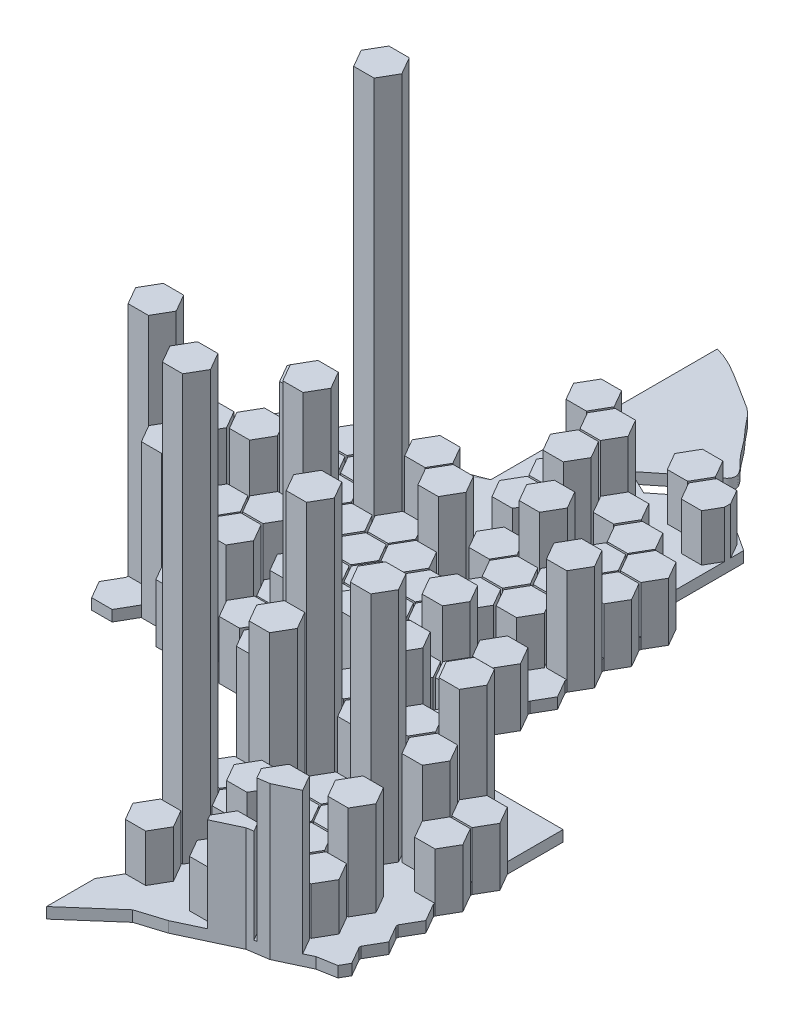
from build123d import *

# Parameters (mm, degrees)
BOSS_EXTRUDE12_DEPTH = 3
BOSS_EXTRUDE13_DEPTH = 120
BOSS_EXTRUDE14_DEPTH = 42
BOSS_EXTRUDE15_DEPTH = 55
BOSS_EXTRUDE16_DEPTH = 68
BOSS_EXTRUDE17_DEPTH = 81
BOSS_EXTRUDE18_DEPTH = 29
BOSS_EXTRUDE19_DEPTH = 16
BOSS_EXTRUDE20_DEPTH = 3
BOSS_EXTRUDE21_DEPTH = 120
BOSS_EXTRUDE22_DEPTH = 81
BOSS_EXTRUDE23_DEPTH = 68
BOSS_EXTRUDE24_DEPTH = 55
BOSS_EXTRUDE25_DEPTH = 42
BOSS_EXTRUDE26_DEPTH = 29
BOSS_EXTRUDE27_DEPTH = 16
BOSS_EXTRUDE28_DEPTH = 3


with BuildPart() as part:
    # Sketch3 → Boss-Extrude12 (new body)
    with BuildSketch(Plane(origin=(0, 0, 0), x_dir=(1, 0, 0), z_dir=(0, 1, 0))):
        with BuildLine():
            add(Edge.make_bspline(
                [(327.696422715, 392.996501101), (333.211608056, 391.498083369), (338.931516771, 386.942494272), (347.132971998, 382.475501932), (349.931165971, 378.312391077), (353.644737091, 374.582038125), (356.261352126, 370.377108225), (359.486044356, 367.677493711), (361.180965416, 364.785458454), (359.784420463, 363.045758677), (358.814740481, 362.845829064)],
                knots=[0, 0, 0, 0, 0.351189458, 0.469328893, 0.584138689, 0.66408283, 0.80511427, 0.892512409, 0.936418584, 1, 1, 1, 1], degree=3))
            Line((327.696422715, 392.996501101), (327.696422715, 330.573102784))
            Line((327.696422715, 330.573102784), (297.971815144, 313.537431679))
            Line((297.971815144, 313.537431679), (297.951251248, 303.301813965))
            Line((297.951251248, 303.301813965), (300.730836157, 308.116196251))
            Line((300.730836157, 308.116196251), (306.331133768, 308.116196251))
            Line((306.331133768, 308.116196251), (309.131282573, 303.266196251))
            Line((309.131282573, 303.266196251), (306.331133768, 298.416196251))
            Line((306.331133768, 298.416196251), (300.730836157, 298.416196251))
            Line((300.730836157, 298.416196251), (297.951108628, 303.230825561))
            Line((297.951108628, 303.230825561), (297.930687351, 293.066196251))
            Line((297.930687351, 293.066196251), (300.730836157, 297.916196251))
            Line((300.730836157, 297.916196251), (306.331133768, 297.916196251))
            Line((306.331133768, 297.916196251), (309.131282573, 293.066196251))
            Line((309.131282573, 293.066196251), (306.331133768, 288.216196251))
            Line((306.331133768, 288.216196251), (300.730836157, 288.216196251))
            Line((300.730836157, 288.216196251), (300.730836157, 287.716196251))
            Line((300.730836157, 287.716196251), (306.331133768, 287.716196251))
            Line((306.331133768, 287.716196251), (309.131282573, 282.866196251))
            Line((309.131282573, 282.866196251), (306.331133768, 278.016196251))
            Line((306.331133768, 278.016196251), (300.730836157, 278.016196251))
            Line((300.730836157, 278.016196251), (297.930687351, 282.866196251))
            Line((297.930687351, 282.866196251), (297.930687351, 272.666196252))
            Line((297.930687351, 272.666196252), (300.730836157, 277.516196252))
            Line((300.730836157, 277.516196252), (306.331133768, 277.516196252))
            Line((306.331133768, 277.516196252), (309.131282573, 272.666196252))
            Line((309.131282573, 272.666196252), (306.331133768, 267.816196252))
            Line((306.331133768, 267.816196252), (300.730836157, 267.816196252))
            Line((300.730836157, 267.816196252), (300.730836157, 267.316196252))
            Line((300.730836157, 267.316196252), (306.331133768, 267.316196252))
            Line((306.331133768, 267.316196252), (309.131282573, 262.466196252))
            Line((309.131282573, 262.466196252), (306.331133768, 257.616196252))
            Line((306.331133768, 257.616196252), (300.730836157, 257.616196252))
            Line((300.730836157, 257.616196252), (300.730836157, 257.001391466))
            Line((300.730836157, 257.001391466), (298.036736799, 252.335074498))
            Line((298.036736799, 252.335074498), (300.856971213, 247.450285203))
            Line((300.856971213, 247.450285203), (306.497440042, 247.450285203))
            Line((306.497440042, 247.450285203), (309.451585771, 252.567015698))
            Line((309.451585771, 252.567015698), (306.680156483, 257.367272033))
            Line((306.680156483, 257.367272033), (309.480305289, 262.217272033))
            Line((309.480305289, 262.217272033), (315.0806029, 262.217272033))
            Line((315.0806029, 262.217272033), (317.880751706, 257.367272033))
            Line((317.880751706, 257.367272033), (315.0806029, 252.517272033))
            Line((315.0806029, 252.517272033), (315.567085831, 252.464504906))
            Line((315.567085831, 252.464504906), (318.367234637, 257.314504906))
            Line((318.367234637, 257.314504906), (323.967532248, 257.314504906))
            Line((323.967532248, 257.314504906), (326.767681054, 252.464504906))
            Line((326.767681054, 252.464504906), (327.180305289, 252.517272033))
            Line((327.180305289, 252.517272033), (324.380156483, 257.367272033))
            Line((324.380156483, 257.367272033), (327.180305289, 262.217272033))
            Line((327.180305289, 262.217272033), (332.7806029, 262.217272033))
            Line((332.7806029, 262.217272033), (335.580751706, 257.367272033))
            Line((335.580751706, 257.367272033), (332.7806029, 252.517272033))
            Line((332.7806029, 252.517272033), (333.111747439, 252.387893043))
            Line((333.111747439, 252.387893043), (335.911896244, 257.237893043))
            Line((335.911896244, 257.237893043), (341.512193856, 257.237893043))
            Line((341.512193856, 257.237893043), (344.312342661, 252.387893043))
            Line((344.312342661, 252.387893043), (344.880305289, 252.517272033))
            Line((344.880305289, 252.517272033), (342.080156483, 257.367272033))
            Line((342.080156483, 257.367272033), (344.880305289, 262.217272033))
            Line((344.880305289, 262.217272033), (350.4806029, 262.217272033))
            Line((350.4806029, 262.217272033), (353.280751705, 257.367272033))
            Line((353.280751705, 257.367272033), (350.4806029, 252.517272033))
            Line((350.4806029, 252.517272033), (350.632478912, 252.377572987))
            Line((350.632478912, 252.377572987), (353.432627718, 257.227572987))
            Line((353.432627718, 257.227572987), (359.032925329, 257.227572987))
            Line((359.032925329, 257.227572987), (361.833074135, 252.377572987))
            Line((361.833074135, 252.377572987), (362.580305288, 252.517272033))
            Line((362.580305288, 252.517272033), (359.780156483, 257.367272033))
            Line((359.780156483, 257.367272033), (362.580305288, 262.217272033))
            Line((362.580305288, 262.217272033), (368.180602899, 262.217272033))
            Line((368.180602899, 262.217272033), (370.980751705, 257.367272033))
            Line((370.980751705, 257.367272033), (371.530836156, 257.616196252))
            Line((371.530836156, 257.616196252), (368.73068735, 262.466196252))
            Line((368.73068735, 262.466196252), (371.530836156, 267.316196252))
            Line((371.530836156, 267.316196252), (377.131133767, 267.316196252))
            Line((377.131133767, 267.316196252), (379.931282572, 262.466196252))
            Line((379.931282572, 262.466196252), (377.131133767, 257.616196252))
            Line((377.131133767, 257.616196252), (377.480156483, 257.367272033))
            Line((377.480156483, 257.367272033), (380.280305288, 252.517272033))
            Line((380.280305288, 252.517272033), (385.880602899, 252.517272033))
            Line((385.880602899, 252.517272033), (388.680751705, 257.367272033))
            Line((388.680751705, 257.367272033), (385.880602899, 262.217272033))
            Line((385.880602899, 262.217272033), (385.880602899, 262.717272032))
            Line((385.880602899, 262.717272032), (380.280305288, 262.717272032))
            Line((380.280305288, 262.717272032), (377.480156483, 267.567272032))
            Line((377.480156483, 267.567272032), (380.280305288, 272.417272032))
            Line((380.280305288, 272.417272032), (385.880602899, 272.417272032))
            Line((385.880602899, 272.417272032), (385.880602899, 272.917272032))
            Line((385.880602899, 272.917272032), (380.280305288, 272.917272032))
            Line((380.280305288, 272.917272032), (377.480156483, 277.767272032))
            Line((377.480156483, 277.767272032), (380.280305288, 282.617272032))
            Line((380.280305288, 282.617272032), (385.880602899, 282.617272032))
            Line((385.880602899, 282.617272032), (385.880602899, 283.117272032))
            Line((385.880602899, 283.117272032), (388.680751705, 287.967272032))
            Line((388.680751705, 287.967272032), (385.880602899, 292.817272032))
            Line((385.880602899, 292.817272032), (385.880602899, 293.317272032))
            Line((385.880602899, 293.317272032), (380.280305288, 293.317272032))
            Line((380.280305288, 293.317272032), (377.480156483, 298.167272032))
            Line((377.480156483, 298.167272032), (380.280305288, 303.017272032))
            Line((380.280305288, 303.017272032), (385.880602899, 303.017272032))
            Line((385.880602899, 303.017272032), (385.880602899, 303.517272032))
            Line((385.880602899, 303.517272032), (380.280305288, 303.517272032))
            Line((380.280305288, 303.517272032), (377.480156483, 308.367272032))
            Line((377.480156483, 308.367272032), (380.280305288, 313.217272032))
            Line((380.280305288, 313.217272032), (385.880602899, 313.217272032))
            Line((385.880602899, 313.217272032), (385.880602899, 313.717272032))
            Line((385.880602899, 313.717272032), (380.280305288, 313.717272032))
            Line((380.280305288, 313.717272032), (377.480156483, 318.567272032))
            Line((377.480156483, 318.567272032), (380.280305288, 323.417272032))
            Line((380.280305288, 323.417272032), (379.931282572, 323.666196251))
            Line((379.931282572, 323.666196251), (377.131133767, 318.816196251))
            Line((377.131133767, 318.816196251), (371.530836156, 318.816196251))
            Line((371.530836156, 318.816196251), (368.73068735, 323.666196251))
            Line((368.73068735, 323.666196251), (371.530836156, 328.516196251))
            Line((371.530836156, 328.516196251), (377.131133767, 328.516196251))
            Line((377.131133767, 328.516196251), (379.433209097, 324.528884816))
            Line((379.433209097, 324.528884816), (379.433209097, 325.384485675))
            Line((379.433209096, 325.384485675), (379.433209097, 342.35005839))
            Line((379.433209097, 342.35005839), (379.433209097, 343.203507686))
            Line((379.433209097, 343.203507686), (377.131133767, 339.216196251))
            Line((377.131133767, 339.216196251), (371.530836156, 339.216196251))
            Line((371.530836156, 339.216196251), (368.73068735, 344.066196251))
            Line((368.73068735, 344.066196251), (371.530836156, 348.916196251))
            Line((371.530836156, 348.916196251), (377.131133767, 348.916196251))
            Line((377.131133767, 348.916196251), (379.433209097, 344.928884816))
            Line((379.433209097, 344.928884816), (379.433209097, 348.497258726))
            Line((379.433209097, 348.497258726), (377.733327772, 349.605777568))
            Line((377.733327772, 349.605777568), (364.284550246, 358.375932917))
            Line((364.284550246, 358.375932917), (351.891304443, 348.497258725))
            Line((351.891304443, 348.497258725), (344.967868406, 351.808467264))
            Line((344.967868406, 351.808467264), (347.738914387, 354.017272032))
            Line((347.738914387, 354.017272031), (358.814740481, 362.845829064))
        make_face()
        Polygon((306.680156483, 267.567272032), (309.480305289, 272.417272032), (315.0806029, 272.417272032), (317.880751706, 267.567272032), (315.0806029, 262.717272032), (309.480305289, 262.717272032), align=None, mode=Mode.SUBTRACT)
        Polygon((318.430836156, 267.316196252), (324.031133767, 267.316196252), (326.831282573, 262.466196252), (324.031133767, 257.616196252), (318.430836156, 257.616196252), (315.630687351, 262.466196252), align=None, mode=Mode.SUBTRACT)
        Polygon((306.680156483, 277.767272032), (309.480305289, 282.617272032), (315.0806029, 282.617272032), (317.880751706, 277.767272032), (315.0806029, 272.917272032), (309.480305289, 272.917272032), align=None, mode=Mode.SUBTRACT)
        Polygon((318.430836156, 277.516196252), (324.031133767, 277.516196252), (326.831282573, 272.666196252), (324.031133767, 267.816196252), (318.430836156, 267.816196252), (315.630687351, 272.666196252), align=None, mode=Mode.SUBTRACT)
        Polygon((318.430836156, 287.716196251), (324.031133767, 287.716196251), (326.831282573, 282.866196251), (324.031133767, 278.016196251), (318.430836156, 278.016196251), (315.630687351, 282.866196251), align=None, mode=Mode.SUBTRACT)
        Polygon((324.380156483, 267.567272032), (327.180305289, 272.417272032), (332.7806029, 272.417272032), (335.580751706, 267.567272032), (332.7806029, 262.717272032), (327.180305289, 262.717272032), align=None, mode=Mode.SUBTRACT)
        Polygon((336.130836156, 267.316196252), (341.731133767, 267.316196252), (344.531282573, 262.466196252), (341.731133767, 257.616196252), (336.130836156, 257.616196252), (333.33068735, 262.466196252), align=None, mode=Mode.SUBTRACT)
        Polygon((324.380156483, 277.767272032), (327.180305289, 282.617272032), (332.7806029, 282.617272032), (335.580751706, 277.767272032), (332.7806029, 272.917272032), (327.180305289, 272.917272032), align=None, mode=Mode.SUBTRACT)
        Polygon((336.130836156, 277.516196252), (341.731133767, 277.516196252), (344.531282573, 272.666196252), (341.731133767, 267.816196252), (336.130836156, 267.816196252), (333.33068735, 272.666196252), align=None, mode=Mode.SUBTRACT)
        Polygon((336.130836156, 287.716196251), (341.731133767, 287.716196251), (344.531282573, 282.866196251), (341.731133767, 278.016196251), (336.130836156, 278.016196251), (333.33068735, 282.866196251), align=None, mode=Mode.SUBTRACT)
        Polygon((306.680156483, 287.967272032), (309.480305289, 292.817272032), (315.0806029, 292.817272032), (317.880751706, 287.967272032), (315.0806029, 283.117272032), (309.480305289, 283.117272032), align=None, mode=Mode.SUBTRACT)
        Polygon((318.430836156, 297.916196251), (324.031133767, 297.916196251), (326.831282573, 293.066196251), (324.031133767, 288.216196251), (318.430836156, 288.216196251), (315.630687351, 293.066196251), align=None, mode=Mode.SUBTRACT)
        Polygon((306.680156483, 298.167272032), (309.480305289, 303.017272032), (315.0806029, 303.017272032), (317.880751706, 298.167272032), (315.0806029, 293.317272032), (309.480305289, 293.317272032), align=None, mode=Mode.SUBTRACT)
        Polygon((318.430836156, 308.116196251), (324.031133767, 308.116196251), (326.831282573, 303.266196251), (324.031133767, 298.416196251), (318.430836156, 298.416196251), (315.630687351, 303.266196251), align=None, mode=Mode.SUBTRACT)
        Polygon((324.380156483, 287.967272032), (327.180305289, 292.817272032), (332.7806029, 292.817272032), (335.580751706, 287.967272032), (332.7806029, 283.117272032), (327.180305289, 283.117272032), align=None, mode=Mode.SUBTRACT)
        Polygon((336.130836156, 297.916196251), (341.731133767, 297.916196251), (344.531282573, 293.066196251), (341.731133767, 288.216196251), (336.130836156, 288.216196251), (333.33068735, 293.066196251), align=None, mode=Mode.SUBTRACT)
        Polygon((324.380156483, 298.167272032), (327.180305289, 303.017272032), (332.7806029, 303.017272032), (335.580751706, 298.167272032), (332.7806029, 293.317272032), (327.180305289, 293.317272032), align=None, mode=Mode.SUBTRACT)
        Polygon((336.130836156, 308.116196251), (341.731133767, 308.116196251), (344.531282573, 303.266196251), (341.731133767, 298.416196251), (336.130836156, 298.416196251), (333.33068735, 303.266196251), align=None, mode=Mode.SUBTRACT)
        Polygon((342.080156483, 267.567272032), (344.880305289, 272.417272032), (350.4806029, 272.417272032), (353.280751705, 267.567272032), (350.4806029, 262.717272032), (344.880305289, 262.717272032), align=None, mode=Mode.SUBTRACT)
        Polygon((353.830836156, 267.316196252), (359.431133767, 267.316196252), (362.231282573, 262.466196252), (359.431133767, 257.616196252), (353.830836156, 257.616196252), (351.03068735, 262.466196252), align=None, mode=Mode.SUBTRACT)
        Polygon((342.080156483, 277.767272032), (344.880305289, 282.617272032), (350.4806029, 282.617272032), (353.280751705, 277.767272032), (350.4806029, 272.917272032), (344.880305289, 272.917272032), align=None, mode=Mode.SUBTRACT)
        Polygon((353.830836156, 277.516196252), (359.431133767, 277.516196252), (362.231282573, 272.666196252), (359.431133767, 267.816196252), (353.830836156, 267.816196252), (351.03068735, 272.666196252), align=None, mode=Mode.SUBTRACT)
        Polygon((353.830836156, 287.716196251), (359.431133767, 287.716196251), (362.231282573, 282.866196251), (359.431133767, 278.016196251), (353.830836156, 278.016196251), (351.03068735, 282.866196251), align=None, mode=Mode.SUBTRACT)
        Polygon((359.780156483, 267.567272032), (362.580305288, 272.417272032), (368.180602899, 272.417272032), (370.980751705, 267.567272032), (368.180602899, 262.717272032), (362.580305288, 262.717272032), align=None, mode=Mode.SUBTRACT)
        Polygon((359.780156483, 277.767272032), (362.580305288, 282.617272032), (368.180602899, 282.617272032), (370.980751705, 277.767272032), (368.180602899, 272.917272032), (362.580305288, 272.917272032), align=None, mode=Mode.SUBTRACT)
        Polygon((371.530836156, 277.516196252), (377.131133767, 277.516196252), (379.931282572, 272.666196252), (377.131133767, 267.816196252), (371.530836156, 267.816196252), (368.73068735, 272.666196252), align=None, mode=Mode.SUBTRACT)
        Polygon((342.080156483, 287.967272032), (344.880305289, 292.817272032), (350.4806029, 292.817272032), (353.280751705, 287.967272032), (350.4806029, 283.117272032), (344.880305289, 283.117272032), align=None, mode=Mode.SUBTRACT)
        Polygon((342.080156483, 298.167272032), (344.880305289, 303.017272032), (350.4806029, 303.017272032), (353.280751705, 298.167272032), (350.4806029, 293.317272032), (344.880305289, 293.317272032), align=None, mode=Mode.SUBTRACT)
        Polygon((353.830836156, 308.116196251), (359.431133767, 308.116196251), (362.231282573, 303.266196251), (359.431133767, 298.416196251), (353.830836156, 298.416196251), (351.03068735, 303.266196251), align=None, mode=Mode.SUBTRACT)
        Polygon((359.780156483, 287.967272032), (362.580305288, 292.817272032), (368.180602899, 292.817272032), (370.980751705, 287.967272032), (368.180602899, 283.117272032), (362.580305288, 283.117272032), align=None, mode=Mode.SUBTRACT)
        Polygon((371.530836156, 297.916196251), (377.131133767, 297.916196251), (379.931282572, 293.066196251), (377.131133767, 288.216196251), (371.530836156, 288.216196251), (368.73068735, 293.066196251), align=None, mode=Mode.SUBTRACT)
        Polygon((359.780156483, 298.167272032), (362.580305288, 303.017272032), (368.180602899, 303.017272032), (370.980751705, 298.167272032), (368.180602899, 293.317272032), (362.580305288, 293.317272032), align=None, mode=Mode.SUBTRACT)
        Polygon((371.530836156, 308.116196251), (377.131133767, 308.116196251), (379.931282572, 303.266196251), (377.131133767, 298.416196251), (371.530836156, 298.416196251), (368.73068735, 303.266196251), align=None, mode=Mode.SUBTRACT)
        Polygon((306.680156483, 308.367272032), (309.480305289, 313.217272032), (315.0806029, 313.217272032), (317.880751706, 308.367272032), (315.0806029, 303.517272032), (309.480305289, 303.517272032), align=None, mode=Mode.SUBTRACT)
        Polygon((324.380156483, 308.367272032), (327.180305289, 313.217272032), (332.7806029, 313.217272032), (335.580751706, 308.367272032), (332.7806029, 303.517272032), (327.180305289, 303.517272032), align=None, mode=Mode.SUBTRACT)
        Polygon((342.080156483, 318.567272032), (344.880305289, 323.417272032), (350.4806029, 323.417272032), (353.280751705, 318.567272032), (350.4806029, 313.717272032), (344.880305289, 313.717272032), align=None, mode=Mode.SUBTRACT)
        Polygon((342.080156483, 328.767272032), (344.880305289, 333.617272032), (350.4806029, 333.617272032), (353.280751705, 328.767272032), (350.4806029, 323.917272032), (344.880305289, 323.917272032), align=None, mode=Mode.SUBTRACT)
        Polygon((353.830836156, 328.516196251), (359.431133767, 328.516196251), (362.231282573, 323.666196251), (359.431133767, 318.816196251), (353.830836156, 318.816196251), (351.03068735, 323.666196251), align=None, mode=Mode.SUBTRACT)
        Polygon((359.780156483, 308.367272032), (362.580305288, 313.217272032), (368.180602899, 313.217272032), (370.980751705, 308.367272032), (368.180602899, 303.517272032), (362.580305288, 303.517272032), align=None, mode=Mode.SUBTRACT)
        Polygon((371.530836156, 318.316196251), (377.131133767, 318.316196251), (379.931282572, 313.466196251), (377.131133767, 308.616196251), (371.530836156, 308.616196251), (368.73068735, 313.466196251), align=None, mode=Mode.SUBTRACT)
        Polygon((359.780156483, 328.767272032), (362.580305288, 333.617272032), (368.180602899, 333.617272032), (370.980751705, 328.767272032), (368.180602899, 323.917272032), (362.580305288, 323.917272032), align=None, mode=Mode.SUBTRACT)
        Polygon((342.080156483, 338.967272032), (344.880305289, 343.817272032), (350.4806029, 343.817272032), (353.280751705, 338.967272032), (350.4806029, 334.117272032), (344.880305289, 334.117272032), align=None, mode=Mode.SUBTRACT)
        Polygon((353.830836156, 338.716196251), (359.431133767, 338.716196251), (362.231282573, 333.866196251), (359.431133767, 329.016196251), (353.830836156, 329.016196251), (351.03068735, 333.866196251), align=None, mode=Mode.SUBTRACT)
        Polygon((359.780156483, 349.167272031), (362.580305288, 354.017272031), (368.180602899, 354.017272031), (370.980751705, 349.167272031), (368.180602899, 344.317272031), (362.580305288, 344.317272031), align=None, mode=Mode.SUBTRACT)
    extrude(amount=BOSS_EXTRUDE12_DEPTH)

    # Sketch3<3> → Boss-Extrude13 (add)
    with BuildSketch(Plane(origin=(0, 0, 0), x_dir=(1, 0, 0), z_dir=(0, 1, 0))):
        Polygon((327.180305289, 303.017272032), (324.380156483, 298.167272032), (327.180305289, 293.317272032), (332.7806029, 293.317272032), (335.580751706, 298.167272032), (332.7806029, 303.017272032), align=None)
    extrude(amount=BOSS_EXTRUDE13_DEPTH)

    # Sketch3<4> → Boss-Extrude14 (add)
    with BuildSketch(Plane(origin=(0, 0, 0), x_dir=(1, 0, 0), z_dir=(0, 1, 0))):
        Polygon((309.480305289, 272.417272032), (306.680156483, 267.567272032), (309.480305289, 262.717272032), (315.0806029, 262.717272032), (317.880751706, 267.567272032), (315.0806029, 272.417272032), align=None)
        Polygon((306.680156483, 257.367272033), (309.480305289, 252.517272033), (315.0806029, 252.517272033), (317.880751706, 257.367272033), (315.0806029, 262.217272033), (309.480305289, 262.217272033), align=None)
        Polygon((318.430836156, 267.816196252), (324.031133767, 267.816196252), (326.831282573, 272.666196252), (324.031133767, 277.516196252), (318.430836156, 277.516196252), (315.630687351, 272.666196252), align=None)
    extrude(amount=BOSS_EXTRUDE14_DEPTH)

    # Sketch3<5> → Boss-Extrude15 (add)
    with BuildSketch(Plane(origin=(0, 0, 0), x_dir=(1, 0, 0), z_dir=(0, 1, 0))):
        Polygon((327.180305289, 282.617272032), (324.380156483, 277.767272032), (327.180305289, 272.917272032), (332.7806029, 272.917272032), (335.580751706, 277.767272032), (332.7806029, 282.617272032), align=None)
    extrude(amount=BOSS_EXTRUDE15_DEPTH)

    # Sketch3<6> → Boss-Extrude16 (add)
    with BuildSketch(Plane(origin=(0, 0, 0), x_dir=(1, 0, 0), z_dir=(0, 1, 0))):
        Polygon((297.930687351, 262.466196252), (300.730836157, 257.616196252), (306.331133768, 257.616196252), (309.131282573, 262.466196252), (306.331133768, 267.316196252), (300.730836157, 267.316196252), align=None)
    extrude(amount=BOSS_EXTRUDE16_DEPTH)

    # Sketch3<8> → Boss-Extrude17 (add)
    with BuildSketch(Plane(origin=(0, 0, 0), x_dir=(1, 0, 0), z_dir=(0, 1, 0))):
        Polygon((353.432627718, 257.227572987), (350.632478912, 252.377572987), (353.432627718, 247.527572987), (359.032925329, 247.527572987), (361.833074135, 252.377572987), (359.032925329, 257.227572987), align=None)
    extrude(amount=BOSS_EXTRUDE17_DEPTH)

    # Sketch3<9> → Boss-Extrude18 (add)
    with BuildSketch(Plane(origin=(0, 0, 0), x_dir=(1, 0, 0), z_dir=(0, 1, 0))):
        Polygon((309.480305289, 292.817272032), (306.680156483, 287.967272032), (309.480305289, 283.117272032), (315.0806029, 283.117272032), (317.880751706, 287.967272032), (315.0806029, 292.817272032), align=None)
        Polygon((344.880305289, 343.817272032), (342.080156483, 338.967272032), (344.880305289, 334.117272032), (350.4806029, 334.117272032), (353.280751705, 338.967272032), (350.4806029, 343.817272032), align=None)
        Polygon((353.830836156, 329.016196251), (359.431133767, 329.016196251), (362.231282573, 333.866196251), (359.431133767, 338.716196251), (353.830836156, 338.716196251), (351.03068735, 333.866196251), align=None)
        Polygon((353.830836156, 318.816196251), (359.431133767, 318.816196251), (362.231282573, 323.666196251), (359.431133767, 328.516196251), (353.830836156, 328.516196251), (351.03068735, 323.666196251), align=None)
        Polygon((362.580305288, 313.217272032), (359.780156483, 308.367272032), (362.580305288, 303.517272032), (368.180602899, 303.517272032), (370.980751705, 308.367272032), (368.180602899, 313.217272032), align=None)
        Polygon((344.880305289, 303.017272032), (342.080156483, 298.167272032), (344.880305289, 293.317272032), (350.4806029, 293.317272032), (353.280751705, 298.167272032), (350.4806029, 303.017272032), align=None)
        Polygon((380.280305288, 303.017272032), (377.480156483, 298.167272032), (380.280305288, 293.317272032), (385.880602899, 293.317272032), (388.680751705, 298.167272032), (385.880602899, 303.017272032), align=None)
        Polygon((371.530836156, 267.816196252), (377.131133767, 267.816196252), (379.931282572, 272.666196252), (377.131133767, 277.516196252), (371.530836156, 277.516196252), (368.73068735, 272.666196252), align=None)
        Polygon((362.580305288, 262.217272033), (359.780156483, 257.367272033), (362.580305288, 252.517272033), (368.180602899, 252.517272033), (370.980751705, 257.367272033), (368.180602899, 262.217272033), align=None)
        Polygon((344.880305289, 262.217272033), (342.080156483, 257.367272033), (344.880305289, 252.517272033), (350.4806029, 252.517272033), (353.280751705, 257.367272033), (350.4806029, 262.217272033), align=None)
        Polygon((327.180305289, 262.217272033), (324.380156483, 257.367272033), (327.180305289, 252.517272033), (332.7806029, 252.517272033), (335.580751706, 257.367272033), (332.7806029, 262.217272033), align=None)
        Polygon((318.430836156, 257.616196252), (324.031133767, 257.616196252), (326.831282573, 262.466196252), (324.031133767, 267.316196252), (318.430836156, 267.316196252), (315.630687351, 262.466196252), align=None)
        Polygon((327.180305289, 272.417272032), (324.380156483, 267.567272032), (327.180305289, 262.717272032), (332.7806029, 262.717272032), (335.580751706, 267.567272032), (332.7806029, 272.417272032), align=None)
        Polygon((336.130836156, 308.116196251), (333.33068735, 303.266196251), (336.130836156, 298.416196251), (341.731133767, 298.416196251), (344.531282573, 303.266196251), (341.731133767, 308.116196251), align=None)
    extrude(amount=BOSS_EXTRUDE18_DEPTH)

    # Sketch3<10> → Boss-Extrude19 (add)
    with BuildSketch(Plane(origin=(0, 0, 0), x_dir=(1, 0, 0), z_dir=(0, 1, 0))):
        Polygon((300.730836157, 308.116196251), (297.951251248, 303.301813965), (297.951108628, 303.230825561), (300.730836157, 298.416196251), (306.331133768, 298.416196251), (309.131282573, 303.266196251), (306.331133768, 308.116196251), align=None)
        Polygon((379.433209097, 343.203507686), (379.433209097, 344.928884816), (377.131133767, 348.916196251), (371.530836156, 348.916196251), (368.73068735, 344.066196251), (371.530836156, 339.216196251), (377.131133767, 339.216196251), align=None)
        Polygon((300.730836157, 297.916196251), (297.930687351, 293.066196251), (300.730836157, 288.216196251), (306.331133768, 288.216196251), (309.131282573, 293.066196251), (306.331133768, 297.916196251), align=None)
        Polygon((306.331133768, 287.716196251), (300.730836157, 287.716196251), (297.930687351, 282.866196251), (300.730836157, 278.016196251), (306.331133768, 278.016196251), (309.131282573, 282.866196251), align=None)
        Polygon((300.730836157, 277.516196252), (297.930687351, 272.666196252), (300.730836157, 267.816196252), (306.331133768, 267.816196252), (309.131282573, 272.666196252), (306.331133768, 277.516196252), align=None)
        Polygon((379.931282572, 323.666196251), (379.433209097, 324.528884816), (377.131133767, 328.516196251), (371.530836156, 328.516196251), (368.73068735, 323.666196251), (371.530836156, 318.816196251), (377.131133767, 318.816196251), align=None)
        Polygon((385.880602899, 323.417272032), (380.280305288, 323.417272032), (377.480156483, 318.567272032), (380.280305288, 313.717272032), (385.880602899, 313.717272032), (388.680751705, 318.567272032), align=None)
        Polygon((388.680751705, 308.367272032), (385.880602899, 313.217272032), (380.280305288, 313.217272032), (377.480156483, 308.367272032), (380.280305288, 303.517272032), (385.880602899, 303.517272032), align=None)
        Polygon((318.367234637, 257.314504906), (315.567085831, 252.464504906), (318.367234637, 247.614504906), (323.967532248, 247.614504906), (326.767681054, 252.464504906), (323.967532248, 257.314504906), align=None)
        Polygon((335.911896244, 257.237893043), (333.111747439, 252.387893043), (335.911896244, 247.537893043), (341.512193856, 247.537893043), (344.312342661, 252.387893043), (341.512193856, 257.237893043), align=None)
        Polygon((388.680751705, 277.767272032), (385.880602899, 282.617272032), (380.280305288, 282.617272032), (377.480156483, 277.767272032), (380.280305288, 272.917272032), (385.880602899, 272.917272032), align=None)
        Polygon((388.680751705, 267.567272032), (385.880602899, 272.417272032), (380.280305288, 272.417272032), (377.480156483, 267.567272032), (380.280305288, 262.717272032), (385.880602899, 262.717272032), align=None)
        Polygon((371.530836156, 257.616196252), (377.131133767, 257.616196252), (379.931282572, 262.466196252), (377.131133767, 267.316196252), (371.530836156, 267.316196252), (368.73068735, 262.466196252), align=None)
        Polygon((344.531282573, 262.466196252), (341.731133767, 267.316196252), (336.130836156, 267.316196252), (333.33068735, 262.466196252), (336.130836156, 257.616196252), (341.731133767, 257.616196252), align=None)
        Polygon((362.231282573, 262.466196252), (359.431133767, 267.316196252), (353.830836156, 267.316196252), (351.03068735, 262.466196252), (353.830836156, 257.616196252), (359.431133767, 257.616196252), align=None)
        Polygon((344.531282573, 272.666196252), (341.731133767, 277.516196252), (336.130836156, 277.516196252), (333.33068735, 272.666196252), (336.130836156, 267.816196252), (341.731133767, 267.816196252), align=None)
        Polygon((350.4806029, 272.417272032), (344.880305289, 272.417272032), (342.080156483, 267.567272032), (344.880305289, 262.717272032), (350.4806029, 262.717272032), (353.280751705, 267.567272032), align=None)
        Polygon((362.231282573, 272.666196252), (359.431133767, 277.516196252), (353.830836156, 277.516196252), (351.03068735, 272.666196252), (353.830836156, 267.816196252), (359.431133767, 267.816196252), align=None)
        Polygon((368.180602899, 272.417272032), (362.580305288, 272.417272032), (359.780156483, 267.567272032), (362.580305288, 262.717272032), (368.180602899, 262.717272032), (370.980751705, 267.567272032), align=None)
        Polygon((326.831282573, 282.866196251), (324.031133767, 287.716196251), (318.430836156, 287.716196251), (315.630687351, 282.866196251), (318.430836156, 278.016196251), (324.031133767, 278.016196251), align=None)
        Polygon((344.531282573, 282.866196251), (341.731133767, 287.716196251), (336.130836156, 287.716196251), (333.33068735, 282.866196251), (336.130836156, 278.016196251), (341.731133767, 278.016196251), align=None)
        Polygon((350.4806029, 282.617272032), (344.880305289, 282.617272032), (342.080156483, 277.767272032), (344.880305289, 272.917272032), (350.4806029, 272.917272032), (353.280751705, 277.767272032), align=None)
        Polygon((362.231282573, 282.866196251), (359.431133767, 287.716196251), (353.830836156, 287.716196251), (351.03068735, 282.866196251), (353.830836156, 278.016196251), (359.431133767, 278.016196251), align=None)
        Polygon((368.180602899, 282.617272032), (362.580305288, 282.617272032), (359.780156483, 277.767272032), (362.580305288, 272.917272032), (368.180602899, 272.917272032), (370.980751705, 277.767272032), align=None)
        Polygon((326.831282573, 293.066196251), (324.031133767, 297.916196251), (318.430836156, 297.916196251), (315.630687351, 293.066196251), (318.430836156, 288.216196251), (324.031133767, 288.216196251), align=None)
        Polygon((332.7806029, 292.817272032), (327.180305289, 292.817272032), (324.380156483, 287.967272032), (327.180305289, 283.117272032), (332.7806029, 283.117272032), (335.580751706, 287.967272032), align=None)
        Polygon((344.531282573, 293.066196251), (341.731133767, 297.916196251), (336.130836156, 297.916196251), (333.33068735, 293.066196251), (336.130836156, 288.216196251), (341.731133767, 288.216196251), align=None)
        Polygon((350.4806029, 292.817272032), (344.880305289, 292.817272032), (342.080156483, 287.967272032), (344.880305289, 283.117272032), (350.4806029, 283.117272032), (353.280751705, 287.967272032), align=None)
        Polygon((368.180602899, 292.817272032), (362.580305288, 292.817272032), (359.780156483, 287.967272032), (362.580305288, 283.117272032), (368.180602899, 283.117272032), (370.980751705, 287.967272032), align=None)
        Polygon((379.931282572, 293.066196251), (377.131133767, 297.916196251), (371.530836156, 297.916196251), (368.73068735, 293.066196251), (371.530836156, 288.216196251), (377.131133767, 288.216196251), align=None)
        Polygon((326.831282573, 303.266196251), (324.031133767, 308.116196251), (318.430836156, 308.116196251), (315.630687351, 303.266196251), (318.430836156, 298.416196251), (324.031133767, 298.416196251), align=None)
        Polygon((362.231282573, 303.266196251), (359.431133767, 308.116196251), (353.830836156, 308.116196251), (351.03068735, 303.266196251), (353.830836156, 298.416196251), (359.431133767, 298.416196251), align=None)
        Polygon((368.180602899, 303.017272032), (362.580305288, 303.017272032), (359.780156483, 298.167272032), (362.580305288, 293.317272032), (368.180602899, 293.317272032), (370.980751705, 298.167272032), align=None)
        Polygon((379.931282572, 303.266196251), (377.131133767, 308.116196251), (371.530836156, 308.116196251), (368.73068735, 303.266196251), (371.530836156, 298.416196251), (377.131133767, 298.416196251), align=None)
        Polygon((332.7806029, 313.217272032), (327.180305289, 313.217272032), (324.380156483, 308.367272032), (327.180305289, 303.517272032), (332.7806029, 303.517272032), (335.580751706, 308.367272032), align=None)
        Polygon((379.931282572, 313.466196251), (377.131133767, 318.316196251), (371.530836156, 318.316196251), (368.73068735, 313.466196251), (371.530836156, 308.616196251), (377.131133767, 308.616196251), align=None)
        Polygon((350.4806029, 323.417272032), (344.880305289, 323.417272032), (342.080156483, 318.567272032), (344.880305289, 313.717272032), (350.4806029, 313.717272032), (353.280751705, 318.567272032), align=None)
        Polygon((350.4806029, 333.617272032), (344.880305289, 333.617272032), (342.080156483, 328.767272032), (344.880305289, 323.917272032), (350.4806029, 323.917272032), (353.280751705, 328.767272032), align=None)
        Polygon((368.180602899, 333.617272032), (362.580305288, 333.617272032), (359.780156483, 328.767272032), (362.580305288, 323.917272032), (368.180602899, 323.917272032), (370.980751705, 328.767272032), align=None)
        Polygon((368.180602899, 354.017272031), (362.580305288, 354.017272031), (359.780156483, 349.167272031), (362.580305288, 344.317272031), (368.180602899, 344.317272031), (370.980751705, 349.167272031), align=None)
        Polygon((315.0806029, 282.617272032), (309.480305289, 282.617272032), (306.680156483, 277.767272032), (309.480305289, 272.917272032), (315.0806029, 272.917272032), (317.880751706, 277.767272032), align=None)
        Polygon((315.0806029, 303.017272032), (309.480305289, 303.017272032), (306.680156483, 298.167272032), (309.480305289, 293.317272032), (315.0806029, 293.317272032), (317.880751706, 298.167272032), align=None)
        Polygon((315.0806029, 313.217272032), (309.480305289, 313.217272032), (306.680156483, 308.367272032), (309.480305289, 303.517272032), (315.0806029, 303.517272032), (317.880751706, 308.367272032), align=None)
    extrude(amount=BOSS_EXTRUDE19_DEPTH)


with BuildPart() as body_2:
    # Sketch4 → Boss-Extrude20 (new body)
    with BuildSketch(Plane(origin=(0, 0, 0), x_dir=(1, 0, 0), z_dir=(0, 1, 0))):
        Polygon((379.785978461, 242.054481381), (376.985829656, 237.204481381), (371.385532045, 237.204481381), (371.385532045, 236.704481381), (376.985829656, 236.704481381), (379.785978461, 231.854481381), (376.985829656, 227.004481381), (371.385532045, 227.004481381), (371.385532045, 226.504481381), (376.985829656, 226.504481381), (379.785978461, 221.654481381), (376.985829656, 216.804481381), (371.385532045, 216.804481381), (371.385532045, 216.304481381), (376.985829656, 216.304481381), (379.785978461, 211.454481381), (376.985829656, 206.604481381), (371.385532045, 206.604481381), (371.385532045, 206.104481381), (376.985829656, 206.104481381), (379.785978461, 201.254481381), (376.985829656, 196.404481381), (371.385532045, 196.404481381), (371.385532045, 195.904481381), (376.985829656, 195.904481381), (379.785978461, 191.054481381), (376.985829656, 186.204481381), (371.385532045, 186.204481381), (368.325536973, 180.904414446), (368.325536973, 167.53360857), (380.979449082, 178.626615859), (388.520051327, 180.99221209), (395.838810226, 184.423049123), (395.019456105, 185.84221209), (397.819604911, 190.69221209), (403.419902522, 190.69221209), (404.923433864, 188.088019414), (405.636824164, 188.194101793), (403.985383239, 191.054481381), (406.785532045, 195.904481381), (412.385829656, 195.904481381), (414.905944963, 191.539513628), (417.379046086, 192.698836819), (422.519976925, 193.61721209), (423.920051327, 196.04221209), (421.119902522, 200.89221209), (421.119902522, 201.39221209), (423.920051327, 206.24221209), (421.119902522, 211.09221209), (421.119902522, 211.59221209), (423.920051327, 216.44221209), (421.119902522, 221.29221209), (421.119902522, 221.79221209), (415.519604911, 221.79221209), (412.719456105, 226.64221209), (415.519604911, 231.49221209), (421.119902522, 231.49221209), (421.119902522, 231.99221209), (415.519604911, 231.99221209), (412.719456105, 236.84221209), (415.519604911, 241.69221209), (421.119902522, 241.69221209), (421.119902522, 257.054548316), (394.680665548, 257.054548316), (397.480814354, 252.204548316), (394.680665548, 247.354548316), (389.080367937, 247.354548316), (386.280219132, 252.204548316), (379.785978461, 252.204548316), (376.985829656, 257.054548316), (371.385532045, 257.054548316), (368.325536973, 252.204548316), (371.385532045, 246.904481381), (376.985829656, 246.904481381), align=None)
        Polygon((397.485978461, 191.054481381), (394.685829656, 186.204481381), (389.085532045, 186.204481381), (386.285383239, 191.054481381), (389.085532045, 195.904481381), (394.685829656, 195.904481381), align=None, mode=Mode.SUBTRACT)
        Polygon((380.119604911, 211.09221209), (385.719902522, 211.09221209), (388.520051327, 206.24221209), (385.719902522, 201.39221209), (380.119604911, 201.39221209), (377.319456105, 206.24221209), align=None, mode=Mode.SUBTRACT)
        Polygon((397.485978461, 201.254481381), (394.685829656, 196.404481381), (389.085532045, 196.404481381), (386.285383239, 201.254481381), (389.085532045, 206.104481381), (394.685829656, 206.104481381), align=None, mode=Mode.SUBTRACT)
        Polygon((397.485978461, 211.454481381), (394.685829656, 206.604481381), (389.085532045, 206.604481381), (386.285383239, 211.454481381), (389.085532045, 216.304481381), (394.685829656, 216.304481381), align=None, mode=Mode.SUBTRACT)
        Polygon((397.819604911, 200.89221209), (403.419902522, 200.89221209), (406.220051327, 196.04221209), (403.419902522, 191.19221209), (397.819604911, 191.19221209), (395.019456105, 196.04221209), align=None, mode=Mode.SUBTRACT)
        Polygon((397.819604911, 211.09221209), (403.419902522, 211.09221209), (406.220051327, 206.24221209), (403.419902522, 201.39221209), (397.819604911, 201.39221209), (395.019456105, 206.24221209), align=None, mode=Mode.SUBTRACT)
        Polygon((415.185978461, 201.254481381), (412.385829656, 196.404481381), (406.785532045, 196.404481381), (403.985383239, 201.254481381), (406.785532045, 206.104481381), (412.385829656, 206.104481381), align=None, mode=Mode.SUBTRACT)
        Polygon((415.185978461, 211.454481381), (412.385829656, 206.604481381), (406.785532045, 206.604481381), (403.985383239, 211.454481381), (406.785532045, 216.304481381), (412.385829656, 216.304481381), align=None, mode=Mode.SUBTRACT)
        Polygon((380.119604911, 221.29221209), (385.719902522, 221.29221209), (388.520051327, 216.44221209), (385.719902522, 211.59221209), (380.119604911, 211.59221209), (377.319456105, 216.44221209), align=None, mode=Mode.SUBTRACT)
        Polygon((397.485978461, 221.654481381), (394.685829656, 216.804481381), (389.085532045, 216.804481381), (386.285383239, 221.654481381), (389.085532045, 226.504481381), (394.685829656, 226.504481381), align=None, mode=Mode.SUBTRACT)
        Polygon((380.119604911, 231.49221209), (385.719902522, 231.49221209), (388.520051327, 226.64221209), (385.719902522, 221.79221209), (380.119604911, 221.79221209), (377.319456105, 226.64221209), align=None, mode=Mode.SUBTRACT)
        Polygon((397.485978461, 231.854481381), (394.685829656, 227.004481381), (389.085532045, 227.004481381), (386.285383239, 231.854481381), (389.085532045, 236.704481381), (394.685829656, 236.704481381), align=None, mode=Mode.SUBTRACT)
        Polygon((388.520051327, 236.84221209), (385.719902522, 231.99221209), (380.119604911, 231.99221209), (377.319456105, 236.84221209), (380.119604911, 241.69221209), (385.719902522, 241.69221209), align=None, mode=Mode.SUBTRACT)
        Polygon((397.485978461, 242.054481381), (394.685829656, 237.204481381), (389.085532045, 237.204481381), (386.285383239, 242.054481381), (389.085532045, 246.904481381), (394.685829656, 246.904481381), align=None, mode=Mode.SUBTRACT)
        Polygon((397.819604911, 221.29221209), (403.419902522, 221.29221209), (406.220051327, 216.44221209), (403.419902522, 211.59221209), (397.819604911, 211.59221209), (395.019456105, 216.44221209), align=None, mode=Mode.SUBTRACT)
        Polygon((397.819604911, 231.49221209), (403.419902522, 231.49221209), (406.220051327, 226.64221209), (403.419902522, 221.79221209), (397.819604911, 221.79221209), (395.019456105, 226.64221209), align=None, mode=Mode.SUBTRACT)
        Polygon((415.185978461, 231.854481381), (412.385829656, 227.004481381), (406.785532045, 227.004481381), (403.985383239, 231.854481381), (406.785532045, 236.704481381), (412.385829656, 236.704481381), align=None, mode=Mode.SUBTRACT)
        Polygon((397.819604911, 241.69221209), (403.419902522, 241.69221209), (406.220051327, 236.84221209), (403.419902522, 231.99221209), (397.819604911, 231.99221209), (395.019456105, 236.84221209), align=None, mode=Mode.SUBTRACT)
        Polygon((415.185978461, 242.054481381), (412.385829656, 237.204481381), (406.785532045, 237.204481381), (403.985383239, 242.054481381), (406.785532045, 246.904481381), (412.385829656, 246.904481381), align=None, mode=Mode.SUBTRACT)
    extrude(amount=BOSS_EXTRUDE20_DEPTH)

    # Sketch4<4> → Boss-Extrude21 (add)
    with BuildSketch(Plane(origin=(0, 0, 0), x_dir=(1, 0, 0), z_dir=(0, 1, 0))):
        Polygon((368.585383239, 201.254481381), (371.385532045, 196.404481381), (376.985829656, 196.404481381), (379.785978461, 201.254481381), (376.985829656, 206.104481381), (371.385532045, 206.104481381), align=None)
    extrude(amount=BOSS_EXTRUDE21_DEPTH)

    # Sketch4<5> → Boss-Extrude22 (add)
    with BuildSketch(Plane(origin=(0, 0, 0), x_dir=(1, 0, 0), z_dir=(0, 1, 0))):
        Polygon((385.719902522, 221.79221209), (388.520051327, 226.64221209), (385.719902522, 231.49221209), (380.119604911, 231.49221209), (377.319456105, 226.64221209), (380.119604911, 221.79221209), align=None)
    extrude(amount=BOSS_EXTRUDE22_DEPTH)

    # Sketch4<6> → Boss-Extrude23 (add)
    with BuildSketch(Plane(origin=(0, 0, 0), x_dir=(1, 0, 0), z_dir=(0, 1, 0))):
        Polygon((403.419902522, 221.79221209), (406.220051327, 226.64221209), (403.419902522, 231.49221209), (397.819604911, 231.49221209), (395.019456105, 226.64221209), (397.819604911, 221.79221209), align=None)
    extrude(amount=BOSS_EXTRUDE23_DEPTH)

    # Sketch4<7> → Boss-Extrude24 (add)
    with BuildSketch(Plane(origin=(0, 0, 0), x_dir=(1, 0, 0), z_dir=(0, 1, 0))):
        Polygon((385.719902522, 211.59221209), (388.520051327, 216.44221209), (385.719902522, 221.29221209), (380.119604911, 221.29221209), (377.319456105, 216.44221209), (380.119604911, 211.59221209), align=None)
    extrude(amount=BOSS_EXTRUDE24_DEPTH)

    # Sketch4<8> → Boss-Extrude25 (add)
    with BuildSketch(Plane(origin=(0, 0, 0), x_dir=(1, 0, 0), z_dir=(0, 1, 0))):
        Polygon((368.585383239, 221.654481381), (371.385532045, 216.804481381), (376.985829656, 216.804481381), (379.785978461, 221.654481381), (376.985829656, 226.504481381), (371.385532045, 226.504481381), align=None)
        Polygon((386.285383239, 242.054481381), (389.085532045, 237.204481381), (394.685829656, 237.204481381), (397.485978461, 242.054481381), (394.685829656, 246.904481381), (389.085532045, 246.904481381), align=None)
        Polygon((403.985383239, 242.054481381), (406.785532045, 237.204481381), (412.385829656, 237.204481381), (415.185978461, 242.054481381), (412.385829656, 246.904481381), (406.785532045, 246.904481381), align=None)
        Polygon((403.985383239, 191.054481381), (405.636824164, 188.194101793), (408.760197772, 188.658552886), (414.905944963, 191.539513628), (412.385829656, 195.904481381), (406.785532045, 195.904481381), align=None)
    extrude(amount=BOSS_EXTRUDE25_DEPTH)

    # Sketch4<9> → Boss-Extrude26 (add)
    with BuildSketch(Plane(origin=(0, 0, 0), x_dir=(1, 0, 0), z_dir=(0, 1, 0))):
        Polygon((377.319456105, 236.84221209), (380.119604911, 231.99221209), (385.719902522, 231.99221209), (388.520051327, 236.84221209), (385.719902522, 241.69221209), (380.119604911, 241.69221209), align=None)
        Polygon((403.985383239, 231.854481381), (406.785532045, 227.004481381), (412.385829656, 227.004481381), (415.185978461, 231.854481381), (412.385829656, 236.704481381), (406.785532045, 236.704481381), align=None)
        Polygon((403.419902522, 231.99221209), (406.220051327, 236.84221209), (403.419902522, 241.69221209), (397.819604911, 241.69221209), (395.019456105, 236.84221209), (397.819604911, 231.99221209), align=None)
        Polygon((386.285383239, 231.854481381), (389.085532045, 227.004481381), (394.685829656, 227.004481381), (397.485978461, 231.854481381), (394.685829656, 236.704481381), (389.085532045, 236.704481381), align=None)
        Polygon((386.285383239, 201.254481381), (389.085532045, 196.404481381), (394.685829656, 196.404481381), (397.485978461, 201.254481381), (394.685829656, 206.104481381), (389.085532045, 206.104481381), align=None)
        Polygon((395.019456105, 185.84221209), (395.838810226, 184.423049123), (403.068670488, 187.812212871), (404.923433864, 188.088019414), (403.419902522, 190.69221209), (397.819604911, 190.69221209), align=None)
        Polygon((403.985383239, 211.454481381), (406.785532045, 206.604481381), (412.385829656, 206.604481381), (415.185978461, 211.454481381), (412.385829656, 216.304481381), (406.785532045, 216.304481381), align=None)
    extrude(amount=BOSS_EXTRUDE26_DEPTH)

    # Sketch4<10> → Boss-Extrude27 (add)
    with BuildSketch(Plane(origin=(0, 0, 0), x_dir=(1, 0, 0), z_dir=(0, 1, 0))):
        Polygon((368.585383239, 242.054481381), (371.385532045, 237.204481381), (376.985829656, 237.204481381), (379.785978461, 242.054481381), (376.985829656, 246.904481381), (371.385532045, 246.904481381), align=None)
        Polygon((386.280219132, 252.204548316), (389.080367937, 247.354548316), (394.680665548, 247.354548316), (397.480814354, 252.204548316), (394.680665548, 257.054548316), (389.080367937, 257.054548316), align=None)
        Polygon((421.119902522, 231.99221209), (423.920051327, 236.84221209), (421.119902522, 241.69221209), (415.519604911, 241.69221209), (412.719456105, 236.84221209), (415.519604911, 231.99221209), align=None)
        Polygon((421.119902522, 221.79221209), (423.920051327, 226.64221209), (421.119902522, 231.49221209), (415.519604911, 231.49221209), (412.719456105, 226.64221209), (415.519604911, 221.79221209), align=None)
        Polygon((403.985383239, 201.254481381), (406.785532045, 196.404481381), (412.385829656, 196.404481381), (415.185978461, 201.254481381), (412.385829656, 206.104481381), (406.785532045, 206.104481381), align=None)
        Polygon((403.419902522, 191.19221209), (406.220051327, 196.04221209), (403.419902522, 200.89221209), (397.819604911, 200.89221209), (395.019456105, 196.04221209), (397.819604911, 191.19221209), align=None)
        Polygon((386.285383239, 191.054481381), (389.085532045, 186.204481381), (394.685829656, 186.204481381), (397.485978461, 191.054481381), (394.685829656, 195.904481381), (389.085532045, 195.904481381), align=None)
        Polygon((368.585383239, 191.054481381), (371.385532045, 186.204481381), (376.985829656, 186.204481381), (379.785978461, 191.054481381), (376.985829656, 195.904481381), (371.385532045, 195.904481381), align=None)
        Polygon((368.585383239, 211.454481381), (371.385532045, 206.604481381), (376.985829656, 206.604481381), (379.785978461, 211.454481381), (376.985829656, 216.304481381), (371.385532045, 216.304481381), align=None)
        Polygon((385.719902522, 201.39221209), (388.520051327, 206.24221209), (385.719902522, 211.09221209), (380.119604911, 211.09221209), (377.319456105, 206.24221209), (380.119604911, 201.39221209), align=None)
        Polygon((386.285383239, 211.454481381), (389.085532045, 206.604481381), (394.685829656, 206.604481381), (397.485978461, 211.454481381), (394.685829656, 216.304481381), (389.085532045, 216.304481381), align=None)
        Polygon((403.419902522, 201.39221209), (406.220051327, 206.24221209), (403.419902522, 211.09221209), (397.819604911, 211.09221209), (395.019456105, 206.24221209), (397.819604911, 201.39221209), align=None)
        Polygon((403.419902522, 211.59221209), (406.220051327, 216.44221209), (403.419902522, 221.29221209), (397.819604911, 221.29221209), (395.019456105, 216.44221209), (397.819604911, 211.59221209), align=None)
        Polygon((386.285383239, 221.654481381), (389.085532045, 216.804481381), (394.685829656, 216.804481381), (397.485978461, 221.654481381), (394.685829656, 226.504481381), (389.085532045, 226.504481381), align=None)
        Polygon((368.585383239, 231.854481381), (371.385532045, 227.004481381), (376.985829656, 227.004481381), (379.785978461, 231.854481381), (376.985829656, 236.704481381), (371.385532045, 236.704481381), align=None)
    extrude(amount=BOSS_EXTRUDE27_DEPTH)


with BuildPart() as body_3:
    # Sketch5 → Boss-Extrude28 (new body)
    with BuildSketch(Plane(origin=(0, 0, 0), x_dir=(1, 0, 0), z_dir=(0, 1, 0))):
        Polygon((297.971815144, 319.037832743), (327.696422715, 330.573102784), (297.971815144, 313.537431679), align=None)
    extrude(amount=BOSS_EXTRUDE28_DEPTH)


solid = Compound([part.part, body_2.part, body_3.part])
